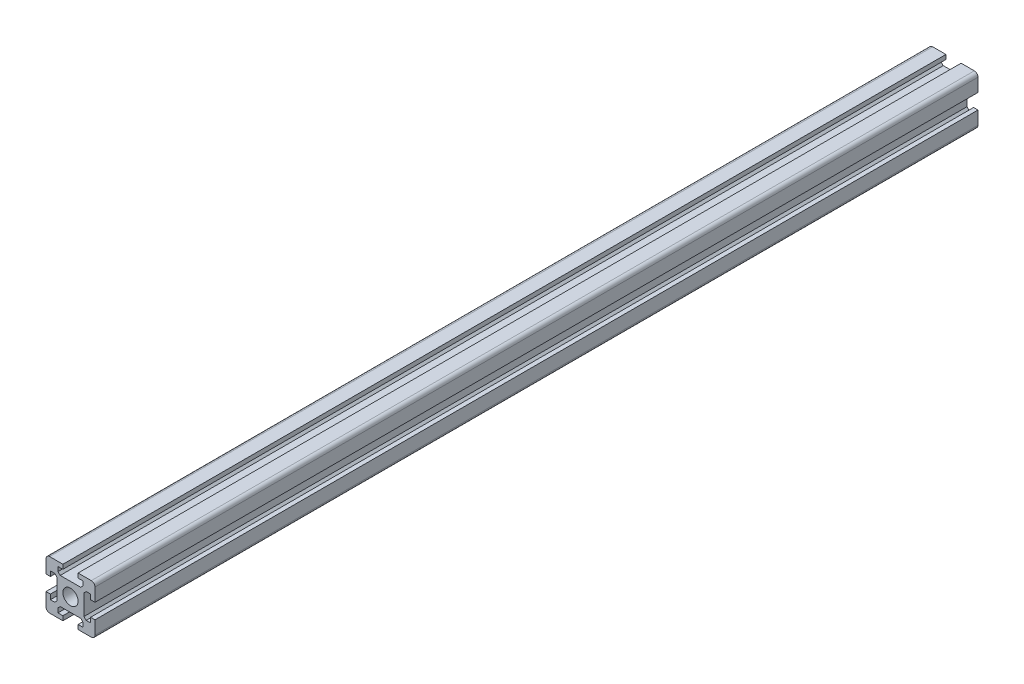
from build123d import *

# Parameters (mm, degrees)
SKETCH1_R           = 3.1
BOSS_EXTRUDE1_DEPTH = 360.5


with BuildPart() as part:
    # Sketch1 → Boss-Extrude1 (new body)
    with BuildSketch(Plane.XY):
        with BuildLine():
            Line((-10, 3.1), (-8.2, 3.1))
            Line((-8.2, 3.1), (-8.2, 5.1))
            Line((-8.2, 5.1), (-6.4, 5.1))
            Line((-6.4, 5.1), (-5.492892349, 4.192892349))
            Line((-5.492892349, 4.192892349), (-5.492892349, -4.192892349))
            Line((-5.492892349, -4.192892349), (-6.4, -5.1))
            Line((-6.4, -5.1), (-8.2, -5.1))
            Line((-8.2, -5.1), (-8.2, -3.1))
            Line((-8.2, -3.1), (-10, -3.1))
            Line((-10, -3.1), (-10, -8.5))
            ThreePointArc((-10, -8.5), (-9.560660172, -9.560660172), (-8.5, -10))
            Line((-8.5, -10), (-3.1, -10))
            Line((-3.1, -10), (-3.1, -8.2))
            Line((-3.1, -8.2), (-5.1, -8.2))
            Line((-5.1, -8.2), (-5.1, -6.4))
            Line((-5.1, -6.4), (-4.192892349, -5.492892349))
            Line((-4.192892349, -5.492892349), (4.192892349, -5.492892349))
            Line((4.192892349, -5.492892349), (5.1, -6.4))
            Line((5.1, -6.4), (5.1, -8.2))
            Line((5.1, -8.2), (3.1, -8.2))
            Line((3.1, -8.2), (3.1, -10))
            Line((3.1, -10), (8.5, -10))
            ThreePointArc((8.5, -10), (9.560660172, -9.560660172), (10, -8.5))
            Line((10, -8.5), (10, -3.1))
            Line((10, -3.1), (8.2, -3.1))
            Line((8.2, -3.1), (8.2, -5.1))
            Line((8.2, -5.1), (6.4, -5.1))
            Line((6.4, -5.1), (5.492892349, -4.192892349))
            Line((5.492892349, -4.192892349), (5.492892349, 4.192892349))
            Line((5.492892349, 4.192892349), (6.4, 5.1))
            Line((6.4, 5.1), (8.2, 5.1))
            Line((8.2, 5.1), (8.2, 3.1))
            Line((8.2, 3.1), (10, 3.1))
            Line((10, 3.1), (10, 8.5))
            ThreePointArc((10, 8.5), (9.560660172, 9.560660172), (8.5, 10))
            Line((8.5, 10), (3.1, 10))
            Line((3.1, 10), (3.1, 8.2))
            Line((3.1, 8.2), (5.1, 8.2))
            Line((5.1, 8.2), (5.1, 6.4))
            Line((5.1, 6.4), (4.192892349, 5.492892349))
            Line((4.192892349, 5.492892349), (-4.192892349, 5.492892349))
            Line((-4.192892349, 5.492892349), (-5.1, 6.4))
            Line((-5.1, 6.4), (-5.1, 8.2))
            Line((-5.1, 8.2), (-3.1, 8.2))
            Line((-3.1, 8.2), (-3.1, 10))
            Line((-3.1, 10), (-8.5, 10))
            ThreePointArc((-8.5, 10), (-9.560660172, 9.560660172), (-10, 8.5))
            Line((-10, 8.5), (-10, 3.1))
        make_face()
        Circle(SKETCH1_R, mode=Mode.SUBTRACT)
    extrude(amount=BOSS_EXTRUDE1_DEPTH)


solid = part.part
